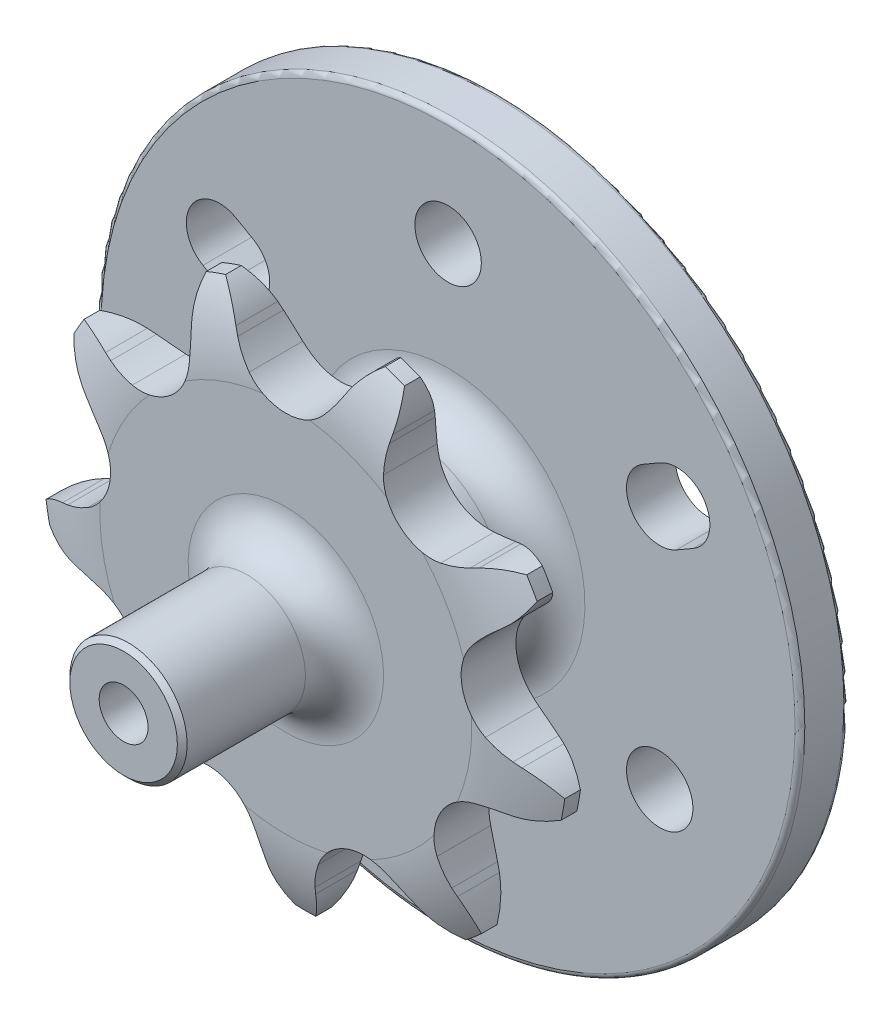
from build123d import *

# Parameters (mm, degrees)
CUT_EXTRUDE1_DEPTH        = 19.987874087
CIRPATTERN1_COUNT         = 9
CUT_EXTRUDE2_DEPTH        = 19.902056051
CUT_EXTRUDE2_DEPTH_BACK   = 19.902056051
SKETCH3_R                 = 3
SKETCH6_R                 = 5
SKETCH6_R_2               = 3
BOSS_EXTRUDE1_DEPTH       = 8
SKETCH7_R                 = 18
BOSS_EXTRUDE2_DEPTH       = 2.5
SKETCH8_R                 = 3
BOSS_EXTRUDE3_DEPTH       = 10.8
SKETCH9_R                 = 3
BOSS_EXTRUDE4_DEPTH       = 8.3
M3_CLEARANCE_HOLE1_D      = 3.4
CIRPATTERN2_COUNT         = 3
M3X0_5_TAPPED_HOLE1_D     = 2.5
M3X0_5_TAPPED_HOLE1_DEPTH = 6
M3X0_5_TAPPED_HOLE1_TIP   = 0.751075774
FILLET1_R                 = 2
FILLET2_R                 = 2
CHAMFER1_SIZE             = 0.25
FILLET3_R                 = 0.25
M3_START                  = -9.4
M3_CLEARANCE_SLOT1_DEPTH  = 2.5
CIRPATTERN3_COUNT         = 3


# Read off the part's stored shape, not the designer's step: M3 Clearance Slot1
with BuildPart() as part:
    # Sketch1 → Revolve1 (revolve)
    with BuildSketch(Plane(origin=(0, 0, 0), x_dir=(0, 0, -1), z_dir=(1, 0, 0))):
        with BuildLine():
            Line((1.4, 0), (-1.4, 0))
            Line((-1.4, 0), (-1.4, 9.516926332))
            ThreePointArc((-1.4, 9.516926332), (-1.145966692, 11.516926332), (-0.4, 13.389909678))
            Line((-0.4, 13.389909678), (0.4, 13.389909678))
            ThreePointArc((0.4, 13.389909678), (1.145966692, 11.516926332), (1.4, 9.516926332))
            Line((1.4, 9.516926332), (1.4, 0))
        make_face()
    revolve(axis=Axis((0, 0, -1.4), (0, 0, 1)))

    # Sketch0 → Cut-Extrude1 (cut, symmetric)
    with BuildSketch(Plane.XY):
        with BuildLine():
            Line((6.616949071, -9.749335721), (6.321966392, -9.500839456))
            ThreePointArc((6.321966392, -9.500839456), (5.785682947, -9.094269701), (5.210515703, -8.744868009))
            ThreePointArc((5.210515703, -8.744868009), (3.127643422, -8.593129679), (1.629606205, -10.048212478))
            ThreePointArc((1.629606205, -10.048212478), (1.413593612, -10.68558008), (1.26411466, -11.341746936))
            Line((1.26411466, -11.341746936), (1.197875138, -11.72171733))
            ThreePointArc((1.197875138, -11.72171733), (-0.715404271, -14.586897371), (-4.122150016, -15.100685451))
            ThreePointArc((-4.122150016, -15.100685451), (5.353711364, -14.709201082), (12.864283619, -8.918129222))
            ThreePointArc((12.864283619, -8.918129222), (9.92430836, -10.714358673), (6.616949071, -9.749335721))
        make_face()
    cut_extrude1 = extrude(amount=CUT_EXTRUDE1_DEPTH, both=True, mode=Mode.SUBTRACT)

    # CirPattern1: Cut-Extrude1 ×9 about axis
    cirpattern1_axis = Axis((0, 0, 0), (0, 0, 1))
    for i in range(1, CIRPATTERN1_COUNT):
        add(cut_extrude1.rotate(cirpattern1_axis, i * 360 / CIRPATTERN1_COUNT), mode=Mode.SUBTRACT)

    # Sketch3 → Cut-Extrude2 (cut, two sides: drawn at the far end of the back side and taken through both)
    with BuildSketch(Plane.XY.offset(-CUT_EXTRUDE2_DEPTH_BACK)):
        with Locations(Location((0, 0, 0), (0, 0, 90))):
            Circle(SKETCH3_R)
    extrude(amount=CUT_EXTRUDE2_DEPTH + CUT_EXTRUDE2_DEPTH_BACK, mode=Mode.SUBTRACT)

    # Sketch6 → Boss-Extrude1 (add)
    with BuildSketch(Plane(origin=(0, 0, -1.4), x_dir=(-1, 0, 0), z_dir=(0, 0, -1))):
        with Locations(Location((0, 0, 0), (0, 0, 90))):
            Circle(SKETCH6_R)
        with Locations(Location((0, 0, 0), (0, 0, 90))):
            Circle(SKETCH6_R_2, mode=Mode.SUBTRACT)
    extrude(amount=BOSS_EXTRUDE1_DEPTH)

    # Sketch7 → Boss-Extrude2 (add)
    with BuildSketch(Plane(origin=(0, 0, -9.4), x_dir=(-1, 0, 0), z_dir=(0, 0, -1))):
        with Locations(Location((0, 0, 0), (0, 0, 90))):
            Circle(SKETCH7_R)
    extrude(amount=-BOSS_EXTRUDE2_DEPTH)

    # Sketch8 → Boss-Extrude3 (add)
    with BuildSketch(Plane.XY.offset(1.4)):
        Circle(SKETCH8_R)
    extrude(amount=-BOSS_EXTRUDE3_DEPTH)

    # Sketch9 → Boss-Extrude4 (add)
    with BuildSketch(Plane.XY.offset(1.4)):
        with Locations(Location((0, 0, 0), (0, 0, 180))):
            Circle(SKETCH9_R)
    extrude(amount=BOSS_EXTRUDE4_DEPTH)

    # M3 Clearance Hole1 (through all)
    with Locations(Plane.XY.offset(-6.9)):
        with Locations((0, 12.5)):
            m3_clearance_hole1 = Hole(M3_CLEARANCE_HOLE1_D / 2)

    # CirPattern2: M3 Clearance Hole1 ×3 about axis
    cirpattern2_axis = Axis((0, 0, 0), (0, 0, 1))
    for i in range(1, CIRPATTERN2_COUNT):
        add(m3_clearance_hole1.rotate(cirpattern2_axis, i * 360 / CIRPATTERN2_COUNT), mode=Mode.SUBTRACT)

    # M3x0.5 Tapped Hole1
    with Locations(Plane.XY.offset(9.7)):
        with Locations((0, 0)):
            Hole(M3X0_5_TAPPED_HOLE1_D / 2, depth=M3X0_5_TAPPED_HOLE1_DEPTH)
            with Locations((0, 0, -(M3X0_5_TAPPED_HOLE1_DEPTH + M3X0_5_TAPPED_HOLE1_TIP / 2))):  # 118° drill point
                Cone(0, M3X0_5_TAPPED_HOLE1_D / 2, M3X0_5_TAPPED_HOLE1_TIP, mode=Mode.SUBTRACT)

    # Fillet1
    fillet1_edges = [part.edges().sort_by_distance(p)[0] for p in [
        (0, -5, -1.4),
        (0, -5, -6.9),
    ]]
    fillet(fillet1_edges, radius=FILLET1_R)

    # Fillet2
    fillet2_edges = [part.edges().sort_by_distance(p)[0] for p in [
        (3, 0, 1.4),
    ]]
    fillet(fillet2_edges, radius=FILLET2_R)

    # Chamfer1
    chamfer1_edges = [part.edges().sort_by_distance(p)[0] for p in [
        (3, 0, 9.7),
    ]]
    chamfer(chamfer1_edges, length=CHAMFER1_SIZE)

    # Fillet3
    fillet3_edges = [part.edges().sort_by_distance(p)[0] for p in [
        (0, -18, -6.9),
        (0, -18, -9.4),
    ]]
    fillet(fillet3_edges, radius=FILLET3_R)

    # M3 Clearance Slot1 outline → M3 Clearance Slot1 (cut)
    with BuildSketch(Plane.XY.offset(M3_START)):
        with BuildLine():
            Line((1.7, -13.500756675), (1.7, -12.500756675))
            ThreePointArc((1.7, -12.500756675), (0, -10.800756675), (-1.7, -12.500756675))
            Line((-1.7, -12.500756675), (-1.7, -13.500756675))
            ThreePointArc((-1.7, -13.500756675), (0, -15.200756675), (1.7, -13.500756675))
        make_face()
    m3_clearance_slot1 = extrude(amount=M3_CLEARANCE_SLOT1_DEPTH, mode=Mode.SUBTRACT)

    # CirPattern3: M3 Clearance Slot1 ×3 about axis
    cirpattern3_axis = Axis((0, 0, 0), (0, 0, 1))
    for i in range(1, CIRPATTERN3_COUNT):
        add(m3_clearance_slot1.rotate(cirpattern3_axis, i * 360 / CIRPATTERN3_COUNT), mode=Mode.SUBTRACT)


solid = part.part
